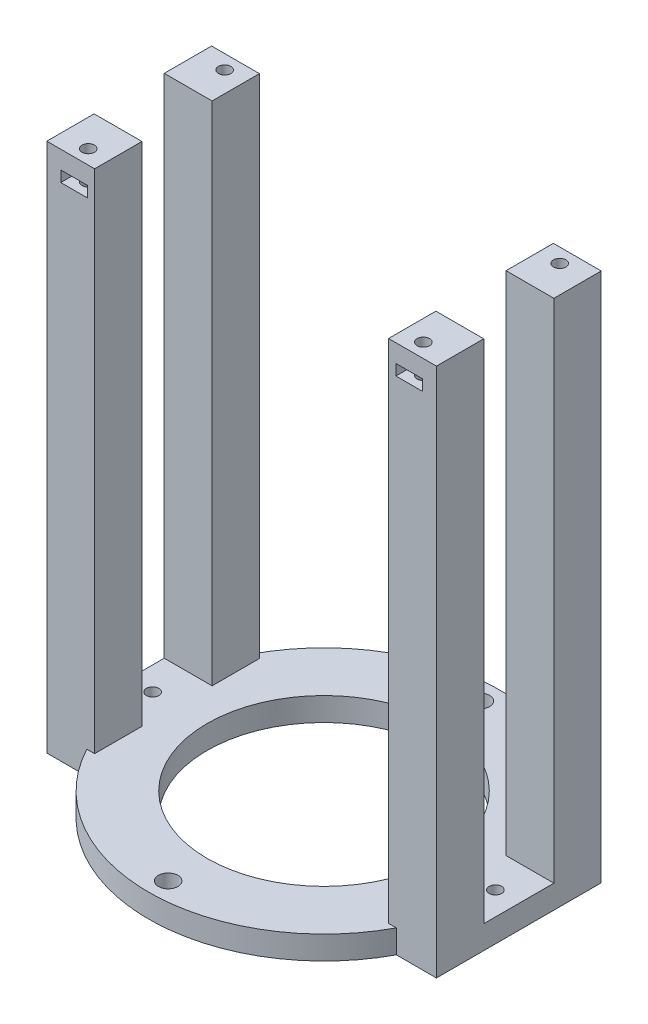
from build123d import *

# Parameters (mm, degrees)
BODY_DEPTH                = 6
SKETCH2_W                 = 12.280011329
SKETCH2_H                 = 42.3
WINGS_DEPTH               = 130
SKETCH3_R                 = 1.6
MOUNTING_BORE_DEPTH       = 152.726728034
CUT_EXCESS_MATERIAL_DEPTH = 175.702604445
CUT_BATTERY_MOUNT_REACH   = 153.727
SKETCH6_R                 = 1.6
SKETCH8_W                 = 6.8
SKETCH8_H                 = 2.8
CAPTURE_NUT_1_DEPTH       = 7.3
CIRPATTERN1_COUNT         = 2
CAPTURE_NUT_2_DEPTH       = 7.3
CIRPATTERN2_COUNT         = 2
CUT_CENTER_HOLE_REACH     = 153.727
SKETCH11_R                = 30
CUT_HARNESS_MOUNT_REACH   = 153.727
SKETCH12_R                = 2.5


with BuildPart() as part:
    # Sketch1 → body (new body)
    with BuildSketch(Plane(origin=(0, 0, 0), x_dir=(1, 0, 0), z_dir=(0, 1, 0))):
        with BuildLine():
            ThreePointArc((-39.719988671, -21.15), (0, -45), (39.719988671, -21.15))
            Line((39.719988671, -21.15), (50, -21.15))
            Line((50, -21.15), (50, 21.15))
            Line((50, 21.15), (39.719988671, 21.15))
            ThreePointArc((39.719988671, 21.15), (0, 45), (-39.719988671, 21.15))
            Line((-39.719988671, 21.15), (-50, 21.15))
            Line((-50, 21.15), (-50, -21.15))
            Line((-50, -21.15), (-39.719988671, -21.15))
        make_face()
    extrude(amount=BODY_DEPTH)

    # Sketch2 → wings (add)
    with BuildSketch(Plane(origin=(0, 6, 0), x_dir=(1, 0, 0), z_dir=(0, 1, 0))):
        with Locations((43.859994336, 0)):
            Rectangle(SKETCH2_W, SKETCH2_H)
        with Locations((-43.859994336, 0)):
            Rectangle(SKETCH2_W, SKETCH2_H)
    extrude(amount=WINGS_DEPTH)

    # Sketch3 → mounting-bore (cut, through all)
    with BuildSketch(Plane(origin=(0, 136, 0), x_dir=(1, 0, 0), z_dir=(0, 1, 0))):
        with Locations((43, -17.5)):
            Circle(SKETCH3_R)
        with Locations((-43, -17.5)):
            Circle(SKETCH3_R)
        with Locations((-43, 17.5)):
            Circle(SKETCH3_R)
        with Locations((43, 17.5)):
            Circle(SKETCH3_R)
    extrude(amount=-MOUNTING_BORE_DEPTH, mode=Mode.SUBTRACT)

    # Sketch5 → cut-excess-material (cut, through all)
    with BuildSketch(Plane(origin=(50, 0, 0), x_dir=(0, 0, -1), z_dir=(1, 0, 0))):
        Polygon((0, 6), (9, 6), (9, 136), (-9, 136), (-9, 6), align=None)
    extrude(amount=-CUT_EXCESS_MATERIAL_DEPTH, mode=Mode.SUBTRACT)

    # Sketch6 → cut-battery-mount (cut, up to next)
    with BuildSketch(Plane.XZ, mode=Mode.PRIVATE) as cut_battery_mount_sk1:
        with Locations((44, 0)):
            Circle(SKETCH6_R)
    cut_battery_mount_tool1 = extrude(cut_battery_mount_sk1.sketch, amount=-CUT_BATTERY_MOUNT_REACH, mode=Mode.PRIVATE) & part.part
    # Sketch6 → cut-battery-mount (cut, up to next)
    with BuildSketch(Plane.XZ, mode=Mode.PRIVATE) as cut_battery_mount_sk2:
        with Locations((-44, 0)):
            Circle(SKETCH6_R)
    cut_battery_mount_tool2 = extrude(cut_battery_mount_sk2.sketch, amount=-CUT_BATTERY_MOUNT_REACH, mode=Mode.PRIVATE) & part.part
    add(cut_battery_mount_tool1.solids().sort_by_distance((44, 0, 0))[0], mode=Mode.SUBTRACT)
    add(cut_battery_mount_tool2.solids().sort_by_distance((-44, 0, 0))[0], mode=Mode.SUBTRACT)

    # Sketch8 → capture-nut-1 (cut)
    with BuildSketch(Plane.XY.offset(21.15)):
        with Locations((42.999988671, 130)):
            Rectangle(SKETCH8_W, SKETCH8_H)
    capture_nut_1 = extrude(amount=-CAPTURE_NUT_1_DEPTH, mode=Mode.SUBTRACT)

    # CirPattern1: capture-nut-1 ×2 about axis
    cirpattern1_axis = Axis((0, 6, 0), (0, 1, 0))
    for i in range(1, CIRPATTERN1_COUNT):
        add(capture_nut_1.rotate(cirpattern1_axis, i * 360 / CIRPATTERN1_COUNT), mode=Mode.SUBTRACT)

    # Sketch10 → capture-nut-2 (cut)
    with BuildSketch(Plane(origin=(0, 0, -21.15), x_dir=(-1, 0, 0), z_dir=(0, 0, -1))):
        Polygon((-42.999988671, 131.4), (-46.399988671, 131.4), (-46.399988671, 128.6), (-39.599988671, 128.6), (-39.599988671, 131.4), align=None)
    capture_nut_2 = extrude(amount=-CAPTURE_NUT_2_DEPTH, mode=Mode.SUBTRACT)

    # CirPattern2: capture-nut-2 ×2 about axis
    cirpattern2_axis = Axis((0, 6, 0), (0, 1, 0))
    for i in range(1, CIRPATTERN2_COUNT):
        add(capture_nut_2.rotate(cirpattern2_axis, i * 360 / CIRPATTERN2_COUNT), mode=Mode.SUBTRACT)

    # Sketch11 → cut-center-hole (cut, up to next)
    with BuildSketch(Plane.XZ, mode=Mode.PRIVATE) as cut_center_hole_sk1:
        Circle(SKETCH11_R)
    cut_center_hole_tool1 = extrude(cut_center_hole_sk1.sketch, amount=-CUT_CENTER_HOLE_REACH, mode=Mode.PRIVATE) & part.part
    add(cut_center_hole_tool1.solids().sort_by_distance((0, 0, 0))[0], mode=Mode.SUBTRACT)

    # Sketch12 → cut-harness-mount (cut, up to next)
    with BuildSketch(Plane.XZ, mode=Mode.PRIVATE) as cut_harness_mount_sk1:
        with Locations((0, -40)):
            Circle(SKETCH12_R)
    cut_harness_mount_tool1 = extrude(cut_harness_mount_sk1.sketch, amount=-CUT_HARNESS_MOUNT_REACH, mode=Mode.PRIVATE) & part.part
    # Sketch12 → cut-harness-mount (cut, up to next)
    with BuildSketch(Plane.XZ, mode=Mode.PRIVATE) as cut_harness_mount_sk2:
        with Locations((0, 40)):
            Circle(SKETCH12_R)
    cut_harness_mount_tool2 = extrude(cut_harness_mount_sk2.sketch, amount=-CUT_HARNESS_MOUNT_REACH, mode=Mode.PRIVATE) & part.part
    add(cut_harness_mount_tool1.solids().sort_by_distance((0, 0, -40))[0], mode=Mode.SUBTRACT)
    add(cut_harness_mount_tool2.solids().sort_by_distance((0, 0, 40))[0], mode=Mode.SUBTRACT)


solid = part.part
